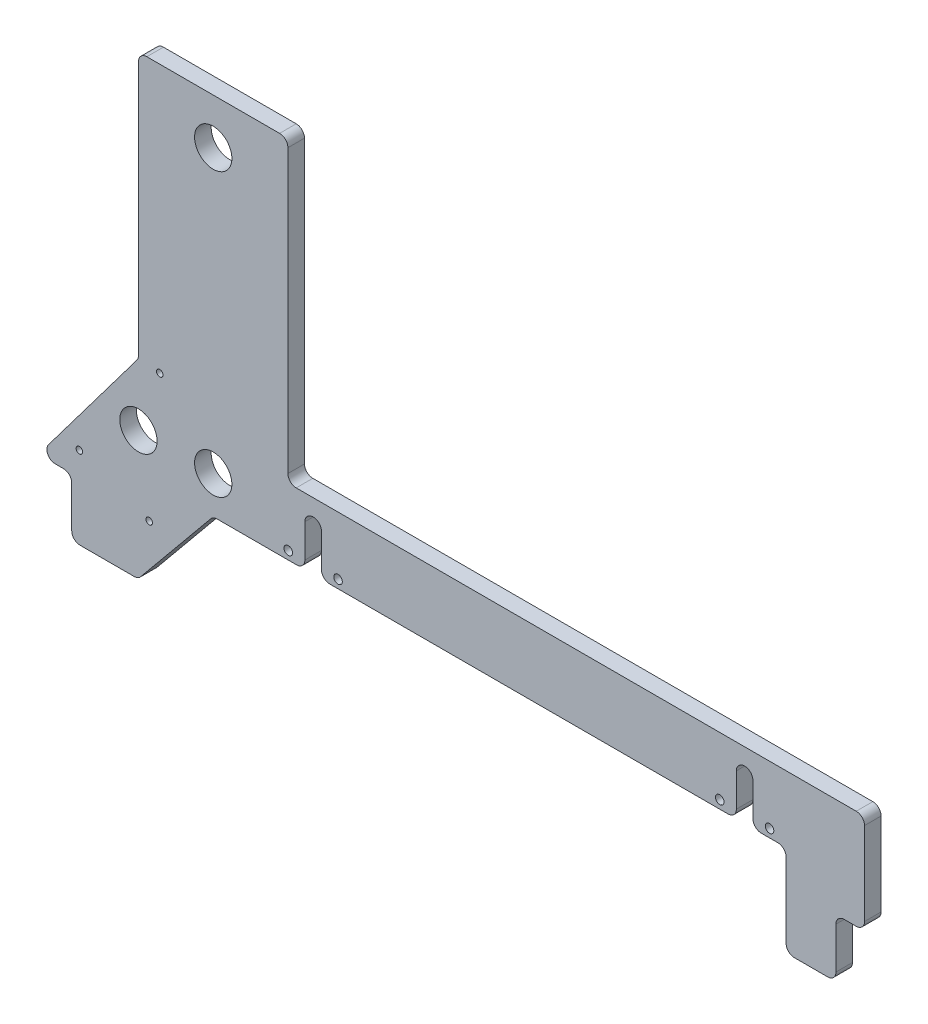
from build123d import *

# Parameters (mm, degrees)
SKETCH1_R           = 14.2748
BOSS_EXTRUDE1_DEPTH = 6.35
SKETCH2_R           = 2.4892
CUT_EXTRUDE1_DEPTH  = 448.798830392
FILLET1_R           = 6.35
SKETCH3_R           = 3.2639
CUT_EXTRUDE2_DEPTH  = 448.798830392
FILLET2_R           = 6.35


with BuildPart() as part:
    # Sketch1 → Boss-Extrude1 (new, symmetric)
    # profile 1 of 2: a face of its own
    with BuildSketch(Plane.XY):
        Polygon((-190.184633538, -88.8238), (-190.184633538, 114.3762), (-304.484633538, 114.3762), (-304.484633538, -88.8238), (-381, -190.5), (-355.6, -190.5), (-355.6, -234.95), (-304.8, -234.95), (-247.334633538, -165.1), (-177.220797536, -165.1), (-177.220797536, -127), (-164.520797536, -127), (-164.520797536, -165.1), (152.979202464, -165.1), (152.979202464, -127), (165.679202464, -127), (165.679202464, -165.1), (191.079202464, -165.1), (191.079202464, -234.95), (229.17754613, -234.95), (229.17754613, -190.5), (251.064839113, -190.5), (251.064839113, -114.2238), (-190.184633538, -114.2238), align=None)
        with Locations((-304.560833538, -136.4488)):
            Circle(SKETCH1_R, mode=Mode.SUBTRACT)
        with Locations((-247.334633538, -136.4488)):
            Circle(SKETCH1_R, mode=Mode.SUBTRACT)
        with Locations((-247.334633538, 79.4512)):
            Circle(SKETCH1_R, mode=Mode.SUBTRACT)
    # profile 2 of 2: a face of its own
    with BuildSketch(Plane.XY):
        Polygon((-190.184633538, -88.8238), (-190.184633538, 114.3762), (-304.484633538, 114.3762), (-304.484633538, -88.8238), (-381, -190.5), (-355.6, -190.5), (-355.6, -234.95), (-304.8, -234.95), (-247.334633538, -165.1), (-177.220797536, -165.1), (-177.220797536, -127), (-164.520797536, -127), (-164.520797536, -165.1), (152.979202464, -165.1), (152.979202464, -127), (165.679202464, -127), (165.679202464, -165.1), (191.079202464, -165.1), (191.079202464, -234.95), (229.17754613, -234.95), (229.17754613, -190.5), (251.064839113, -190.5), (251.064839113, -114.2238), (-190.184633538, -114.2238), align=None)
        with Locations((-304.560833538, -136.4488)):
            Circle(SKETCH1_R, mode=Mode.SUBTRACT)
        with Locations((-247.334633538, -136.4488)):
            Circle(SKETCH1_R, mode=Mode.SUBTRACT)
        with Locations((-247.334633538, 79.4512)):
            Circle(SKETCH1_R, mode=Mode.SUBTRACT)
    extrude(amount=BOSS_EXTRUDE1_DEPTH, both=True)

    # Sketch2 → Cut-Extrude1 (cut, through all)
    with BuildSketch(Plane.XY.offset(6.35)):
        with Locations((-288.22680671, -90.447274763)):
            Circle(SKETCH2_R)
        with Locations((-349.758, -172.212)):
            Circle(SKETCH2_R)
        with Locations((-296.314296632, -192.457816118)):
            Circle(SKETCH2_R)
    extrude(amount=-CUT_EXTRUDE1_DEPTH, mode=Mode.SUBTRACT)

    # Fillet1
    fillet1_edges = [part.edges().sort_by_distance(p)[0] for p in [
        (152.979202464, -127, 0),
        (165.679202464, -127, 0),
        (-164.520797536, -127, 0),
        (-177.220797536, -127, 0),
    ]]
    fillet(fillet1_edges, radius=FILLET1_R - 0.0001)  # a hair under: the kernel refuses the full size

    # Sketch3 → Cut-Extrude2 (cut, through all)
    with BuildSketch(Plane.XY.offset(6.35)):
        with Locations((-189.920797536, -158.75)):
            Circle(SKETCH3_R)
        with Locations((178.379202464, -158.75)):
            Circle(SKETCH3_R)
        with Locations((-151.820797536, -158.75)):
            Circle(SKETCH3_R)
        with Locations((140.279202464, -158.75)):
            Circle(SKETCH3_R)
    extrude(amount=-CUT_EXTRUDE2_DEPTH, mode=Mode.SUBTRACT)

    # Fillet2
    fillet2_edges = [part.edges().sort_by_distance(p)[0] for p in [
        (251.064839113, -190.5, 0),
        (229.17754613, -190.5, 0),
        (229.17754613, -234.95, 0),
        (191.079202464, -234.95, 0),
        (191.079202464, -165.1, 0),
        (165.679202464, -165.1, 0),
        (152.979202464, -165.1, 0),
        (-164.520797536, -165.1, 0),
        (-177.220797536, -165.1, 0),
        (-247.334633538, -165.1, 0),
        (-304.8, -234.95, 0),
        (-355.6, -234.95, 0),
        (-355.6, -190.5, 0),
        (-381, -190.5, 0),
        (-304.484633538, -88.8238, 0),
        (-304.484633538, 114.3762, 0),
        (-190.184633538, 114.3762, 0),
        (-190.184633538, -114.2238, 0),
        (251.064839113, -114.2238, 0),
    ]]
    fillet(fillet2_edges, radius=FILLET2_R)


solid = part.part
